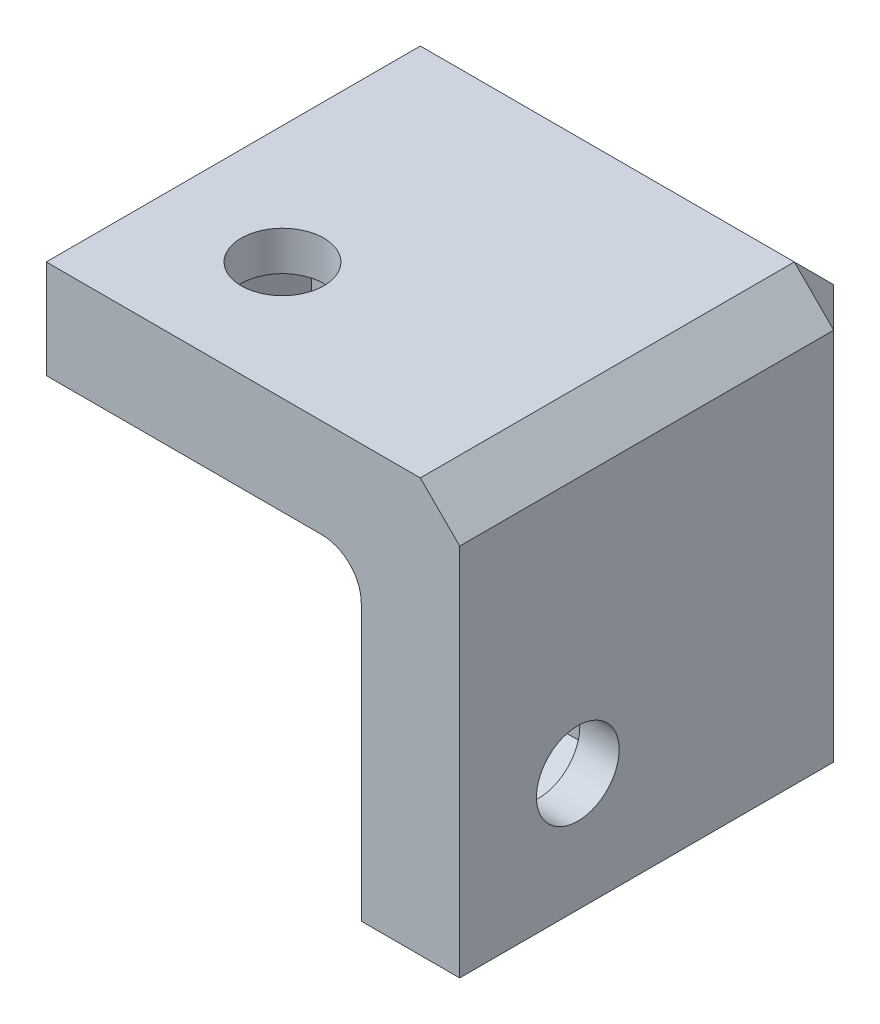
from build123d import *

# Parameters (mm, degrees)
SKETCH1_W           = 21
SKETCH1_H           = 21
BOSS_EXTRUDE1_DEPTH = 5
BOSS_EXTRUDE2_DEPTH = 16
SKETCH3_R           = 2.1
CUT_EXTRUDE1_DEPTH  = 3
SKETCH4_R           = 2.1
CUT_EXTRUDE2_DEPTH  = 3
SKETCH5_R           = 2.1
CUT_EXTRUDE3_DEPTH  = 3
CUT_EXTRUDE4_DEPTH  = 3
CUT_EXTRUDE5_DEPTH  = 3
CUT_EXTRUDE6_DEPTH  = 3
CHAMFER1_SIZE       = 2
FILLET1_R           = 2


with BuildPart() as part:
    # Sketch1 → Boss-Extrude1 (new body)
    with BuildSketch(Plane.XY):
        with Locations((10.5, 10.5)):
            Rectangle(SKETCH1_W, SKETCH1_H)
    extrude(amount=BOSS_EXTRUDE1_DEPTH)

    # Sketch2 → Boss-Extrude2 (add)
    with BuildSketch(Plane.XY.offset(5)):
        Polygon((0, 21), (21, 21), (21, 0), (16, 0), (16, 16), (0, 16), align=None)
    extrude(amount=BOSS_EXTRUDE2_DEPTH)

    # Sketch3 → Cut-Extrude1 (cut)
    with BuildSketch(Plane(origin=(0, 21, 0), x_dir=(1, 0, 0), z_dir=(0, 1, 0))):
        with Locations((6, -15)):
            Circle(SKETCH3_R)
    extrude(amount=-CUT_EXTRUDE1_DEPTH, mode=Mode.SUBTRACT)

    # Sketch4 → Cut-Extrude2 (cut)
    with BuildSketch(Plane(origin=(21, 0, 0), x_dir=(0, 0, -1), z_dir=(1, 0, 0))):
        with Locations((-15, 6)):
            Circle(SKETCH4_R)
    extrude(amount=-CUT_EXTRUDE2_DEPTH, mode=Mode.SUBTRACT)

    # Sketch5 → Cut-Extrude3 (cut)
    with BuildSketch(Plane(origin=(0, 0, 0), x_dir=(-1, 0, 0), z_dir=(0, 0, -1))):
        with Locations((-6, 6)):
            Circle(SKETCH5_R)
    extrude(amount=-CUT_EXTRUDE3_DEPTH, mode=Mode.SUBTRACT)

    # Sketch6 → Cut-Extrude4 (cut)
    with BuildSketch(Plane.ZY.offset(-16)):
        Polygon((18.5, 3.979274058), (18.5, 8.020725942), (15, 10.041451884), (11.5, 8.020725942), (11.5, 3.979274058), (15, 1.958548116), align=None)
    extrude(amount=-CUT_EXTRUDE4_DEPTH, mode=Mode.SUBTRACT)

    # Sketch7 → Cut-Extrude5 (cut)
    with BuildSketch(Plane.XY.offset(5)):
        Polygon((9.5, 3.979274058), (9.5, 8.020725942), (6, 10.041451884), (2.5, 8.020725942), (2.5, 3.979274058), (6, 1.958548116), align=None)
    extrude(amount=-CUT_EXTRUDE5_DEPTH, mode=Mode.SUBTRACT)

    # Sketch8 → Cut-Extrude6 (cut)
    with BuildSketch(Plane.XZ.offset(-16)):
        Polygon((8.020725942, 11.5), (10.041451884, 15), (8.020725942, 18.5), (3.979274058, 18.5), (1.958548116, 15), (3.979274058, 11.5), align=None)
    extrude(amount=-CUT_EXTRUDE6_DEPTH, mode=Mode.SUBTRACT)

    # Chamfer1
    chamfer1_edges = [part.edges().sort_by_distance(p)[0] for p in [
        (21, 21, 10.5),
        (10.5, 21, 0),
        (21, 10.5, 0),
    ]]
    chamfer(chamfer1_edges, length=CHAMFER1_SIZE)

    # Fillet1
    fillet1_edges = [part.edges().sort_by_distance(p)[0] for p in [
        (8, 16, 5),
        (16, 8, 5),
        (16, 16, 13),
    ]]
    fillet(fillet1_edges, radius=FILLET1_R)


solid = part.part
